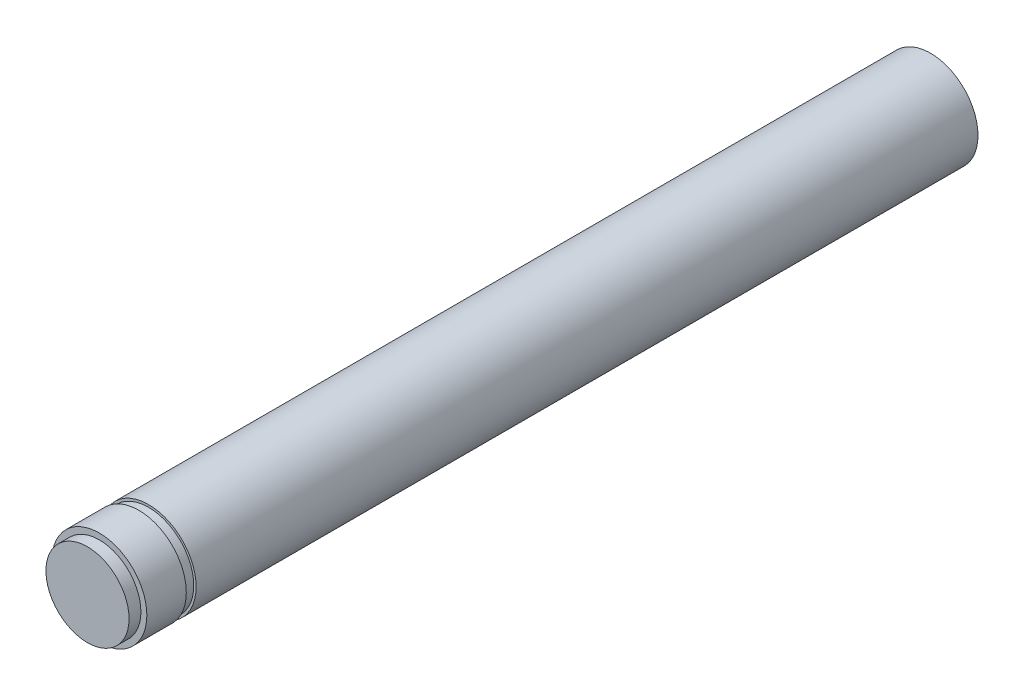
from build123d import *


with BuildPart() as part:
    # Sketch2 → Revolve1 (revolve)
    with BuildSketch(Plane(origin=(0, 0, 0), x_dir=(1, 0, 0), z_dir=(0, 1, 0))):
        Polygon((0, 0), (0, -70), (0, -71), (3.5, -71), (3.5, -70), (4, -70), (4, -66.6762), (3.8, -66.6762), (3.8, -65.8508), (4, -65.8508), (4, 0), align=None)
    revolve(axis=Axis((0, 0, 25.914367816), (0, 0, -1)))


solid = part.part
